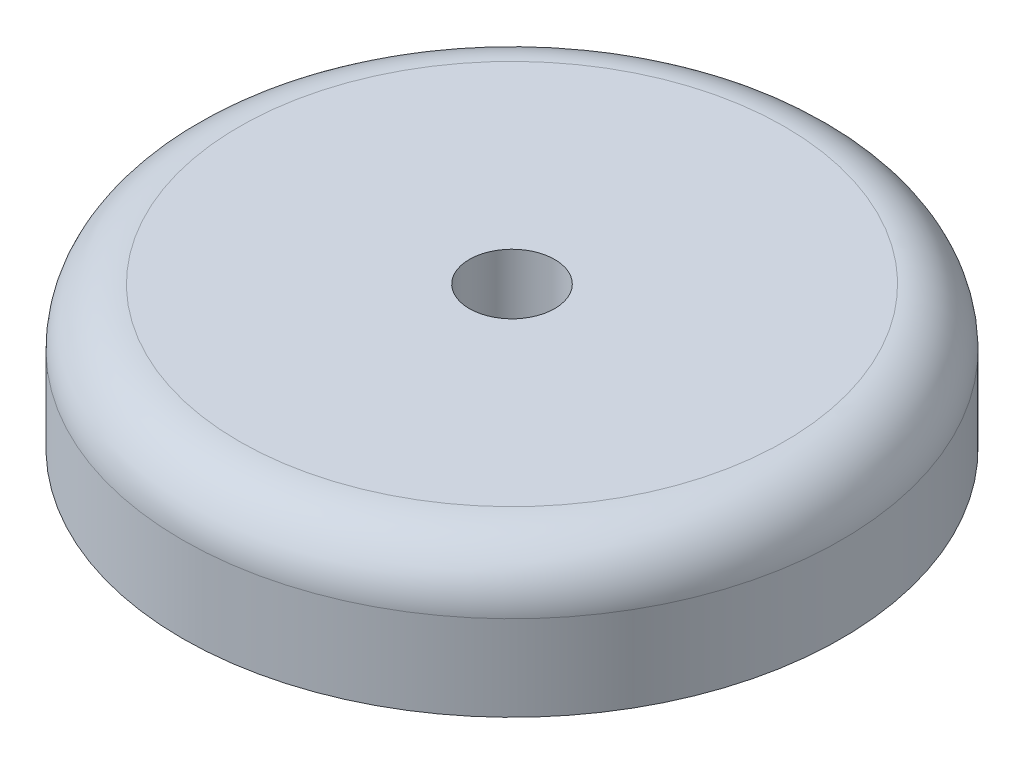
from build123d import *

# Parameters (mm, degrees)
SKETCH1_R           = 11.587
SKETCH1_R_2         = 1.5
BOSS_EXTRUDE1_DEPTH = 5
FILLET1_R           = 2


with BuildPart() as part:
    # Sketch1 → Boss-Extrude1 (new body)
    with BuildSketch(Plane(origin=(0, 0, 0), x_dir=(1, 0, 0), z_dir=(0, 1, 0))):
        Circle(SKETCH1_R)
        Circle(SKETCH1_R_2, mode=Mode.SUBTRACT)
    extrude(amount=BOSS_EXTRUDE1_DEPTH)

    # Fillet1
    fillet1_edges = [part.edges().sort_by_distance(p)[0] for p in [
        (-11.587, 5, 0),
    ]]
    fillet(fillet1_edges, radius=FILLET1_R)


solid = part.part
